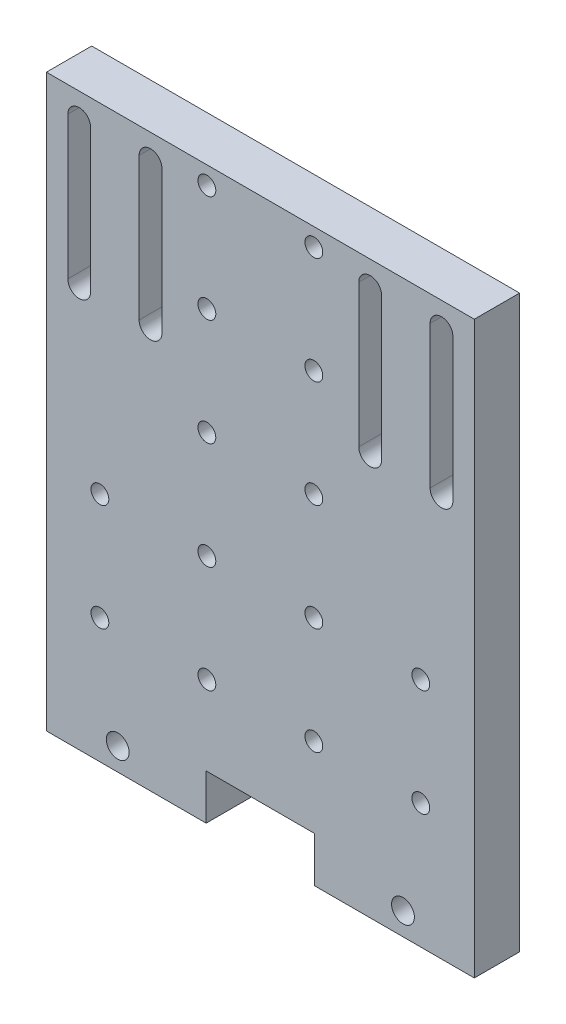
from build123d import *

# Parameters (mm, degrees)
BOSS_EXTRUDE1_DEPTH         = 6.35
CUT_EXTRUDE1_DEPTH          = 115.616872582
CUT_EXTRUDE2_DEPTH          = 115.616872582
CUT_EXTRUDE3_DEPTH          = 115.616872582
CUT_EXTRUDE4_DEPTH          = 115.616872582
F_2_5_2_5_DIAMETER_HOLE1_D  = 2.5
F_3_2_3_2_DIAMETER_HOLE1_D  = 3.2
F_2_5_2_5_DIAMETER_HOLE2_D  = 2.5
F_2_5_2_5_DIAMETER_HOLE3_D  = 2.5
F_2_5_2_5_DIAMETER_HOLE4_D  = 2.5
F_2_5_2_5_DIAMETER_HOLE5_D  = 2.5
F_2_5_2_5_DIAMETER_HOLE6_D  = 2.5
F_2_5_2_5_DIAMETER_HOLE7_D  = 2.5
F_2_5_2_5_DIAMETER_HOLE8_D  = 2.5
F_2_5_2_5_DIAMETER_HOLE9_D  = 2.5
F_2_5_2_5_DIAMETER_HOLE10_D = 2.5
F_2_5_2_5_DIAMETER_HOLE11_D = 2.5
F_2_5_2_5_DIAMETER_HOLE12_D = 2.5
F_2_5_2_5_DIAMETER_HOLE13_D = 2.5
F_2_5_2_5_DIAMETER_HOLE14_D = 2.5
F_3_2_3_2_DIAMETER_HOLE2_D  = 3.2


with BuildPart() as part:
    # Sketch1 → Boss-Extrude1 (new body)
    with BuildSketch(Plane.XY.offset(118.288574318)):
        Polygon((19.634665341, 82.188959457), (19.634665341, 2.188959457), (42.034665341, 2.188959457), (42.034665341, 8.538959457), (57.234665341, 8.538959457), (57.234665341, 2.188959457), (79.634665341, 2.188959457), (79.634665341, 82.188959457), align=None)
    extrude(amount=-BOSS_EXTRUDE1_DEPTH)

    # Sketch2 → Cut-Extrude1 (cut, through all)
    with BuildSketch(Plane(origin=(0, 0, 111.938574318), x_dir=(-1, 0, 0), z_dir=(0, 0, -1))):
        with BuildLine():
            Line((-66.634665341, 78.588959457), (-66.634665341, 58.588959457))
            ThreePointArc((-66.634665341, 58.588959457), (-65.034665341, 56.988959457), (-63.434665341, 58.588959457))
            Line((-63.434665341, 58.588959457), (-63.434665341, 78.588959457))
            ThreePointArc((-63.434665341, 78.588959457), (-65.034665341, 80.188959457), (-66.634665341, 78.588959457))
        make_face()
    extrude(amount=-CUT_EXTRUDE1_DEPTH, mode=Mode.SUBTRACT)

    # Sketch3 → Cut-Extrude2 (cut, through all)
    with BuildSketch(Plane(origin=(0, 0, 111.938574318), x_dir=(-1, 0, 0), z_dir=(0, 0, -1))):
        with BuildLine():
            Line((-35.834665341, 78.588959457), (-35.834665341, 58.588959457))
            ThreePointArc((-35.834665341, 58.588959457), (-34.234665341, 56.988959457), (-32.634665341, 58.588959457))
            Line((-32.634665341, 58.588959457), (-32.634665341, 78.588959457))
            ThreePointArc((-32.634665341, 78.588959457), (-34.234665341, 80.188959457), (-35.834665341, 78.588959457))
        make_face()
    extrude(amount=-CUT_EXTRUDE2_DEPTH, mode=Mode.SUBTRACT)

    # Sketch4 → Cut-Extrude3 (cut, through all)
    with BuildSketch(Plane(origin=(0, 0, 111.938574318), x_dir=(-1, 0, 0), z_dir=(0, 0, -1))):
        with BuildLine():
            Line((-73.434665341, 58.588959457), (-73.434665341, 78.588959457))
            ThreePointArc((-73.434665341, 78.588959457), (-75.034665341, 80.188959457), (-76.634665341, 78.588959457))
            Line((-76.634665341, 78.588959457), (-76.634665341, 58.588959457))
            ThreePointArc((-76.634665341, 58.588959457), (-75.034665341, 56.988959457), (-73.434665341, 58.588959457))
        make_face()
    extrude(amount=-CUT_EXTRUDE3_DEPTH, mode=Mode.SUBTRACT)

    # Sketch5 → Cut-Extrude4 (cut, through all)
    with BuildSketch(Plane(origin=(0, 0, 111.938574318), x_dir=(-1, 0, 0), z_dir=(0, 0, -1))):
        with BuildLine():
            Line((-25.834665341, 78.588959457), (-25.834665341, 58.588959457))
            ThreePointArc((-25.834665341, 58.588959457), (-24.234665341, 56.988959457), (-22.634665341, 58.588959457))
            Line((-22.634665341, 58.588959457), (-22.634665341, 78.588959457))
            ThreePointArc((-22.634665341, 78.588959457), (-24.234665341, 80.188959457), (-25.834665341, 78.588959457))
        make_face()
    extrude(amount=-CUT_EXTRUDE4_DEPTH, mode=Mode.SUBTRACT)

    # Ø2.5 (2.5) Diameter Hole1 (through all)
    with Locations(Plane(origin=(0, 0, 111.938574318), x_dir=(-1, 0, 0), z_dir=(0, 0, -1))):
        with Locations((-27.134665341, 19.688959457)):
            Hole(F_2_5_2_5_DIAMETER_HOLE1_D / 2)

    # Ø3.2 (3.2) Diameter Hole1 (through all)
    with Locations(Plane.XY.offset(118.288574318)):
        with Locations((29.634665341, 5.363959457)):
            Hole(F_3_2_3_2_DIAMETER_HOLE1_D / 2)

    # Ø2.5 (2.5) Diameter Hole2 (through all)
    with Locations(Plane(origin=(0, 0, 111.938574318), x_dir=(-1, 0, 0), z_dir=(0, 0, -1))):
        with Locations((-57.134665341, 19.688959457)):
            Hole(F_2_5_2_5_DIAMETER_HOLE2_D / 2)

    # Ø2.5 (2.5) Diameter Hole3 (through all)
    with Locations(Plane(origin=(0, 0, 111.938574318), x_dir=(-1, 0, 0), z_dir=(0, 0, -1))):
        with Locations((-42.134665341, 34.688959457)):
            Hole(F_2_5_2_5_DIAMETER_HOLE3_D / 2)

    # Ø2.5 (2.5) Diameter Hole4 (through all)
    with Locations(Plane(origin=(0, 0, 111.938574318), x_dir=(-1, 0, 0), z_dir=(0, 0, -1))):
        with Locations((-42.134665341, 64.688959457)):
            Hole(F_2_5_2_5_DIAMETER_HOLE4_D / 2)

    # Ø2.5 (2.5) Diameter Hole5 (through all)
    with Locations(Plane(origin=(0, 0, 111.938574318), x_dir=(-1, 0, 0), z_dir=(0, 0, -1))):
        with Locations((-57.134665341, 64.688959457)):
            Hole(F_2_5_2_5_DIAMETER_HOLE5_D / 2)

    # Ø2.5 (2.5) Diameter Hole6 (through all)
    with Locations(Plane(origin=(0, 0, 111.938574318), x_dir=(-1, 0, 0), z_dir=(0, 0, -1))):
        with Locations((-27.134665341, 34.688959457)):
            Hole(F_2_5_2_5_DIAMETER_HOLE6_D / 2)

    # Ø2.5 (2.5) Diameter Hole7 (through all)
    with Locations(Plane(origin=(0, 0, 111.938574318), x_dir=(-1, 0, 0), z_dir=(0, 0, -1))):
        with Locations((-72.134665341, 19.688959457)):
            Hole(F_2_5_2_5_DIAMETER_HOLE7_D / 2)

    # Ø2.5 (2.5) Diameter Hole8 (through all)
    with Locations(Plane(origin=(0, 0, 111.938574318), x_dir=(-1, 0, 0), z_dir=(0, 0, -1))):
        with Locations((-42.134665341, 19.688959457)):
            Hole(F_2_5_2_5_DIAMETER_HOLE8_D / 2)

    # Ø2.5 (2.5) Diameter Hole9 (through all)
    with Locations(Plane(origin=(0, 0, 111.938574318), x_dir=(-1, 0, 0), z_dir=(0, 0, -1))):
        with Locations((-57.134665341, 34.688959457)):
            Hole(F_2_5_2_5_DIAMETER_HOLE9_D / 2)

    # Ø2.5 (2.5) Diameter Hole10 (through all)
    with Locations(Plane(origin=(0, 0, 111.938574318), x_dir=(-1, 0, 0), z_dir=(0, 0, -1))):
        with Locations((-42.134665341, 49.688959457)):
            Hole(F_2_5_2_5_DIAMETER_HOLE10_D / 2)

    # Ø2.5 (2.5) Diameter Hole11 (through all)
    with Locations(Plane(origin=(0, 0, 111.938574318), x_dir=(-1, 0, 0), z_dir=(0, 0, -1))):
        with Locations((-42.134665341, 79.688959457)):
            Hole(F_2_5_2_5_DIAMETER_HOLE11_D / 2)

    # Ø2.5 (2.5) Diameter Hole12 (through all)
    with Locations(Plane(origin=(0, 0, 111.938574318), x_dir=(-1, 0, 0), z_dir=(0, 0, -1))):
        with Locations((-57.134665341, 79.688959457)):
            Hole(F_2_5_2_5_DIAMETER_HOLE12_D / 2)

    # Ø2.5 (2.5) Diameter Hole13 (through all)
    with Locations(Plane(origin=(0, 0, 111.938574318), x_dir=(-1, 0, 0), z_dir=(0, 0, -1))):
        with Locations((-57.134665341, 49.688959457)):
            Hole(F_2_5_2_5_DIAMETER_HOLE13_D / 2)

    # Ø2.5 (2.5) Diameter Hole14 (through all)
    with Locations(Plane(origin=(0, 0, 111.938574318), x_dir=(-1, 0, 0), z_dir=(0, 0, -1))):
        with Locations((-72.134665341, 34.688959457)):
            Hole(F_2_5_2_5_DIAMETER_HOLE14_D / 2)

    # Ø3.2 (3.2) Diameter Hole2 (through all)
    with Locations(Plane.XY.offset(118.288574318)):
        with Locations((69.634665341, 5.363959457)):
            Hole(F_3_2_3_2_DIAMETER_HOLE2_D / 2)


solid = part.part
